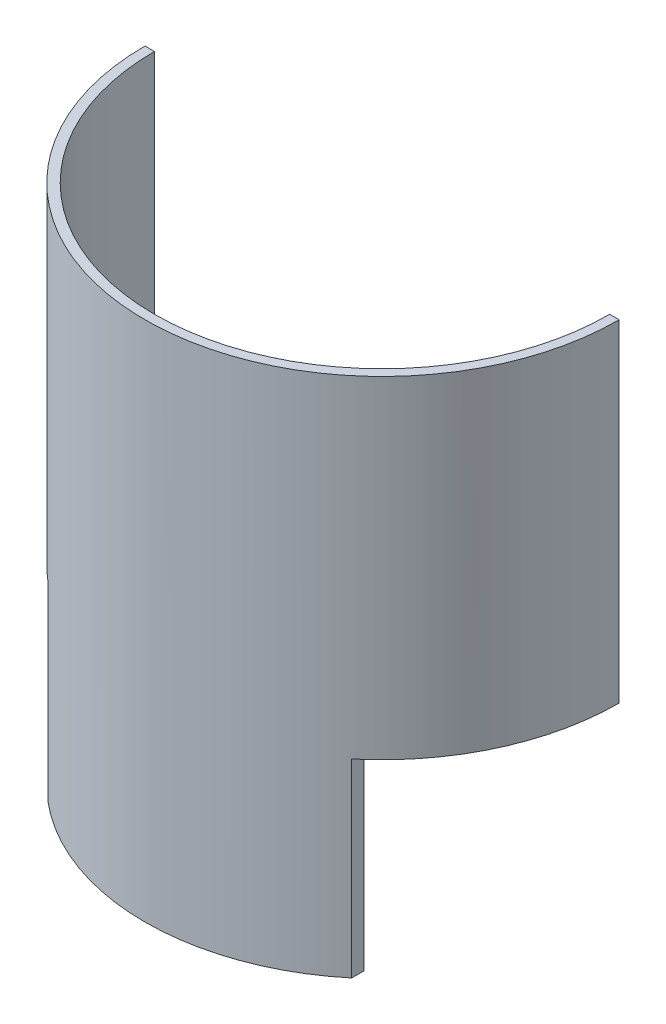
from build123d import *

# Parameters (mm, degrees)
BOSS_EXTRUDE1_DEPTH = 10
BOSS_EXTRUDE2_START = 10
BOSS_EXTRUDE2_DEPTH = 17.5


with BuildPart() as part:
    # Sketch1 → Boss-Extrude1 (new body)
    with BuildSketch(Plane(origin=(0, 0, 0), x_dir=(1, 0, 0), z_dir=(0, 1, 0))):
        with BuildLine():
            Line((-8, -8.94427191), (-8, -9.604686356))
            ThreePointArc((-8, -9.604686356), (0, -12.5), (8, -9.604686356))
            Line((8, -9.604686356), (8, -8.94427191))
            ThreePointArc((8, -8.94427191), (0, -12), (-8, -8.94427191))
        make_face()
    extrude(amount=BOSS_EXTRUDE1_DEPTH)

    # Sketch1<3> → Boss-Extrude2 (add)
    with BuildSketch(Plane(origin=(0, 0, 0), x_dir=(1, 0, 0), z_dir=(0, 1, 0)).offset(BOSS_EXTRUDE2_START)):
        with BuildLine():
            Line((-12, 0), (-12.5, 0))
            ThreePointArc((-12.5, 0), (0, -12.5), (12.5, 0))
            Line((12.5, 0), (12, 0))
            ThreePointArc((12, 0), (0, -12), (-12, 0))
        make_face()
    extrude(amount=BOSS_EXTRUDE2_DEPTH)


solid = part.part
